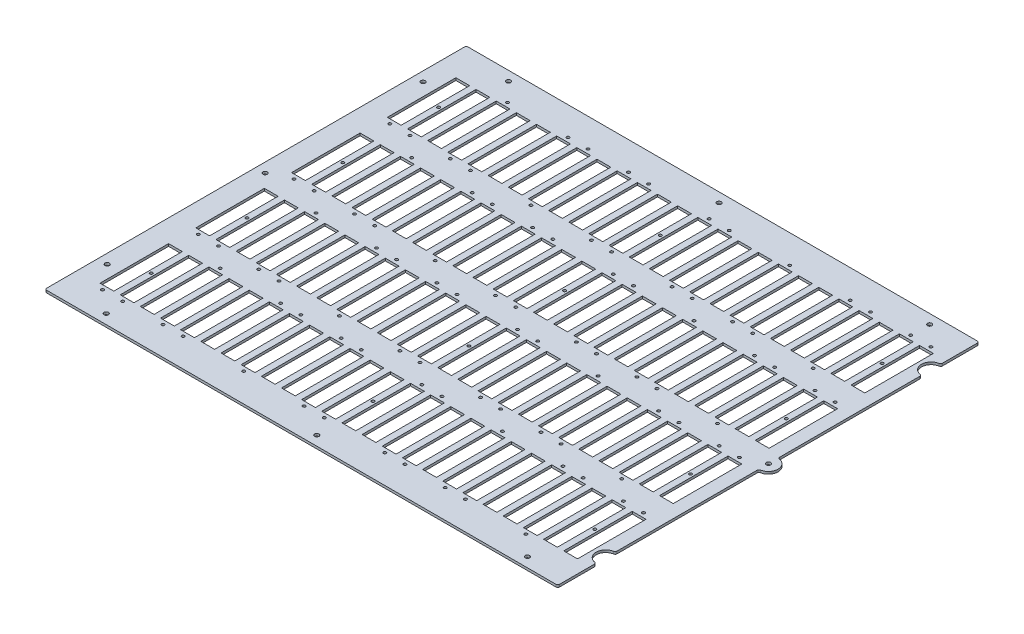
from build123d import *

# Parameters (mm, degrees)
BOSS_EXTRUDE1_DEPTH          = 3.175
SKETCH17_W                   = 18.288
SKETCH17_H                   = 90.932
CUT_EXTRUDE5_DEPTH           = 451.265762746
F_25_0_1495_DIAMETER_HOLE1_D = 3.7973
FILLET1_R                    = 2.54
F_6_CLEARANCE_HOLE1_D        = 3.7973
F_1_0_228_DIAMETER_HOLE1_D   = 5.7912


with BuildPart() as part:
    # Sketch1 → Boss-Extrude1 (new body)
    with BuildSketch(Plane(origin=(0, 0, 0), x_dir=(1, 0, 0), z_dir=(0, 1, 0))):
        with BuildLine():
            Line((340.2584, 228.6), (340.2584, 279.5524))
            Line((340.2584, 279.5524), (-340.2584, 279.5524))
            Line((-340.2584, 279.5524), (-340.2584, -279.5524))
            Line((-340.2584, -279.5524), (340.2584, -279.5524))
            Line((340.2584, -279.5524), (340.2584, -228.6))
            ThreePointArc((340.2584, -228.6), (327.5584, -215.9), (340.2584, -203.2))
            Line((340.2584, -203.2), (340.2584, -12.7))
            ThreePointArc((340.2584, -12.7), (352.9584, 0), (340.2584, 12.7))
            Line((340.2584, 12.7), (340.2584, 203.2))
            ThreePointArc((340.2584, 203.2), (327.5584, 215.9), (340.2584, 228.6))
        make_face()
    extrude(amount=BOSS_EXTRUDE1_DEPTH)

    # Sketch17 → Cut-Extrude5 (cut, through all)
    with BuildSketch(Plane(origin=(0, 3.175, 0), x_dir=(1, 0, 0), z_dir=(0, 1, 0))):
        with Locations((-274.696582609, 190.6524)):
            Rectangle(SKETCH17_W, SKETCH17_H)
        with Locations((-301.4472, 190.6524)):
            Rectangle(SKETCH17_W, SKETCH17_H)
        with Locations((-247.945965217, 190.6524)):
            Rectangle(SKETCH17_W, SKETCH17_H)
        with Locations((-221.195347826, 190.6524)):
            Rectangle(SKETCH17_W, SKETCH17_H)
        with Locations((-194.444730435, 190.6524)):
            Rectangle(SKETCH17_W, SKETCH17_H)
        with Locations((-167.694113043, 190.6524)):
            Rectangle(SKETCH17_W, SKETCH17_H)
        with Locations((-140.943495652, 190.6524)):
            Rectangle(SKETCH17_W, SKETCH17_H)
        with Locations((-114.192878261, 190.6524)):
            Rectangle(SKETCH17_W, SKETCH17_H)
        with Locations((-87.44226087, 190.6524)):
            Rectangle(SKETCH17_W, SKETCH17_H)
        with Locations((-60.691643478, 190.6524)):
            Rectangle(SKETCH17_W, SKETCH17_H)
        with Locations((-33.941026087, 190.6524)):
            Rectangle(SKETCH17_W, SKETCH17_H)
        with Locations((-7.190408696, 190.6524)):
            Rectangle(SKETCH17_W, SKETCH17_H)
        with Locations((19.560208696, 190.6524)):
            Rectangle(SKETCH17_W, SKETCH17_H)
        with Locations((46.310826087, 190.6524)):
            Rectangle(SKETCH17_W, SKETCH17_H)
        with Locations((73.061443478, 190.6524)):
            Rectangle(SKETCH17_W, SKETCH17_H)
        with Locations((99.81206087, 190.6524)):
            Rectangle(SKETCH17_W, SKETCH17_H)
        with Locations((126.562678261, 190.6524)):
            Rectangle(SKETCH17_W, SKETCH17_H)
        with Locations((153.313295652, 190.6524)):
            Rectangle(SKETCH17_W, SKETCH17_H)
        with Locations((180.063913043, 190.6524)):
            Rectangle(SKETCH17_W, SKETCH17_H)
        with Locations((206.814530435, 190.6524)):
            Rectangle(SKETCH17_W, SKETCH17_H)
        with Locations((233.565147826, 190.6524)):
            Rectangle(SKETCH17_W, SKETCH17_H)
        with Locations((260.315765217, 190.6524)):
            Rectangle(SKETCH17_W, SKETCH17_H)
        with Locations((287.066382609, 190.6524)):
            Rectangle(SKETCH17_W, SKETCH17_H)
        with Locations((313.817, 190.6524)):
            Rectangle(SKETCH17_W, SKETCH17_H)
        with Locations((-274.696582609, 63.5762)):
            Rectangle(SKETCH17_W, SKETCH17_H)
        with Locations((-247.945965217, 63.5762)):
            Rectangle(SKETCH17_W, SKETCH17_H)
        with Locations((-221.195347826, 63.5762)):
            Rectangle(SKETCH17_W, SKETCH17_H)
        with Locations((-194.444730435, 63.5762)):
            Rectangle(SKETCH17_W, SKETCH17_H)
        with Locations((-167.694113043, 63.5762)):
            Rectangle(SKETCH17_W, SKETCH17_H)
        with Locations((-140.943495652, 63.5762)):
            Rectangle(SKETCH17_W, SKETCH17_H)
        with Locations((-114.192878261, 63.5762)):
            Rectangle(SKETCH17_W, SKETCH17_H)
        with Locations((-87.44226087, 63.5762)):
            Rectangle(SKETCH17_W, SKETCH17_H)
        with Locations((-60.691643478, 63.5762)):
            Rectangle(SKETCH17_W, SKETCH17_H)
        with Locations((-33.941026087, 63.5762)):
            Rectangle(SKETCH17_W, SKETCH17_H)
        with Locations((-7.190408696, 63.5762)):
            Rectangle(SKETCH17_W, SKETCH17_H)
        with Locations((19.560208696, 63.5762)):
            Rectangle(SKETCH17_W, SKETCH17_H)
        with Locations((46.310826087, 63.5762)):
            Rectangle(SKETCH17_W, SKETCH17_H)
        with Locations((73.061443478, 63.5762)):
            Rectangle(SKETCH17_W, SKETCH17_H)
        with Locations((99.81206087, 63.5762)):
            Rectangle(SKETCH17_W, SKETCH17_H)
        with Locations((126.562678261, 63.5762)):
            Rectangle(SKETCH17_W, SKETCH17_H)
        with Locations((153.313295652, 63.5762)):
            Rectangle(SKETCH17_W, SKETCH17_H)
        with Locations((180.063913043, 63.5762)):
            Rectangle(SKETCH17_W, SKETCH17_H)
        with Locations((206.814530435, 63.5762)):
            Rectangle(SKETCH17_W, SKETCH17_H)
        with Locations((233.565147826, 63.5762)):
            Rectangle(SKETCH17_W, SKETCH17_H)
        with Locations((260.315765217, 63.5762)):
            Rectangle(SKETCH17_W, SKETCH17_H)
        with Locations((287.066382609, 63.5762)):
            Rectangle(SKETCH17_W, SKETCH17_H)
        with Locations((313.817, 63.5762)):
            Rectangle(SKETCH17_W, SKETCH17_H)
        with Locations((-274.696582609, -63.5)):
            Rectangle(SKETCH17_W, SKETCH17_H)
        with Locations((-247.945965217, -63.5)):
            Rectangle(SKETCH17_W, SKETCH17_H)
        with Locations((-221.195347826, -63.5)):
            Rectangle(SKETCH17_W, SKETCH17_H)
        with Locations((-194.444730435, -63.5)):
            Rectangle(SKETCH17_W, SKETCH17_H)
        with Locations((-167.694113043, -63.5)):
            Rectangle(SKETCH17_W, SKETCH17_H)
        with Locations((-140.943495652, -63.5)):
            Rectangle(SKETCH17_W, SKETCH17_H)
        with Locations((-114.192878261, -63.5)):
            Rectangle(SKETCH17_W, SKETCH17_H)
        with Locations((-87.44226087, -63.5)):
            Rectangle(SKETCH17_W, SKETCH17_H)
        with Locations((-60.691643478, -63.5)):
            Rectangle(SKETCH17_W, SKETCH17_H)
        with Locations((-33.941026087, -63.5)):
            Rectangle(SKETCH17_W, SKETCH17_H)
        with Locations((-7.190408696, -63.5)):
            Rectangle(SKETCH17_W, SKETCH17_H)
        with Locations((19.560208696, -63.5)):
            Rectangle(SKETCH17_W, SKETCH17_H)
        with Locations((46.310826087, -63.5)):
            Rectangle(SKETCH17_W, SKETCH17_H)
        with Locations((73.061443478, -63.5)):
            Rectangle(SKETCH17_W, SKETCH17_H)
        with Locations((99.81206087, -63.5)):
            Rectangle(SKETCH17_W, SKETCH17_H)
        with Locations((126.562678261, -63.5)):
            Rectangle(SKETCH17_W, SKETCH17_H)
        with Locations((153.313295652, -63.5)):
            Rectangle(SKETCH17_W, SKETCH17_H)
        with Locations((180.063913043, -63.5)):
            Rectangle(SKETCH17_W, SKETCH17_H)
        with Locations((206.814530435, -63.5)):
            Rectangle(SKETCH17_W, SKETCH17_H)
        with Locations((233.565147826, -63.5)):
            Rectangle(SKETCH17_W, SKETCH17_H)
        with Locations((260.315765217, -63.5)):
            Rectangle(SKETCH17_W, SKETCH17_H)
        with Locations((287.066382609, -63.5)):
            Rectangle(SKETCH17_W, SKETCH17_H)
        with Locations((313.817, -63.5)):
            Rectangle(SKETCH17_W, SKETCH17_H)
        with Locations((-274.696582609, -190.5762)):
            Rectangle(SKETCH17_W, SKETCH17_H)
        with Locations((-247.945965217, -190.5762)):
            Rectangle(SKETCH17_W, SKETCH17_H)
        with Locations((-221.195347826, -190.5762)):
            Rectangle(SKETCH17_W, SKETCH17_H)
        with Locations((-194.444730435, -190.5762)):
            Rectangle(SKETCH17_W, SKETCH17_H)
        with Locations((-167.694113043, -190.5762)):
            Rectangle(SKETCH17_W, SKETCH17_H)
        with Locations((-140.943495652, -190.5762)):
            Rectangle(SKETCH17_W, SKETCH17_H)
        with Locations((-114.192878261, -190.5762)):
            Rectangle(SKETCH17_W, SKETCH17_H)
        with Locations((-87.44226087, -190.5762)):
            Rectangle(SKETCH17_W, SKETCH17_H)
        with Locations((-60.691643478, -190.5762)):
            Rectangle(SKETCH17_W, SKETCH17_H)
        with Locations((-33.941026087, -190.5762)):
            Rectangle(SKETCH17_W, SKETCH17_H)
        with Locations((-7.190408696, -190.5762)):
            Rectangle(SKETCH17_W, SKETCH17_H)
        with Locations((19.560208696, -190.5762)):
            Rectangle(SKETCH17_W, SKETCH17_H)
        with Locations((46.310826087, -190.5762)):
            Rectangle(SKETCH17_W, SKETCH17_H)
        with Locations((73.061443478, -190.5762)):
            Rectangle(SKETCH17_W, SKETCH17_H)
        with Locations((99.81206087, -190.5762)):
            Rectangle(SKETCH17_W, SKETCH17_H)
        with Locations((126.562678261, -190.5762)):
            Rectangle(SKETCH17_W, SKETCH17_H)
        with Locations((153.313295652, -190.5762)):
            Rectangle(SKETCH17_W, SKETCH17_H)
        with Locations((180.063913043, -190.5762)):
            Rectangle(SKETCH17_W, SKETCH17_H)
        with Locations((206.814530435, -190.5762)):
            Rectangle(SKETCH17_W, SKETCH17_H)
        with Locations((233.565147826, -190.5762)):
            Rectangle(SKETCH17_W, SKETCH17_H)
        with Locations((260.315765217, -190.5762)):
            Rectangle(SKETCH17_W, SKETCH17_H)
        with Locations((287.066382609, -190.5762)):
            Rectangle(SKETCH17_W, SKETCH17_H)
        with Locations((313.817, -190.5762)):
            Rectangle(SKETCH17_W, SKETCH17_H)
        with Locations((-301.4472, 63.5762)):
            Rectangle(SKETCH17_W, SKETCH17_H)
        with Locations((-301.4472, -63.5)):
            Rectangle(SKETCH17_W, SKETCH17_H)
        with Locations((-301.4472, -190.5762)):
            Rectangle(SKETCH17_W, SKETCH17_H)
    extrude(amount=-CUT_EXTRUDE5_DEPTH, mode=Mode.SUBTRACT)

    # #25 (0.1495) Diameter Hole1 (through all)
    with Locations(Plane(origin=(0, 3.175, 0), x_dir=(1, 0, 0), z_dir=(0, 1, 0))):
        with Locations((-301.447198222, 139.3444), (313.817, -139.2682), (287.066382686, -139.2682), (260.315765372, -241.8842), (233.565148058, -139.2682), (206.814530744, -139.2682), (180.06391343, -241.8842), (153.313296116, -241.8842), (126.562678802, -139.2682), (99.812061488, -241.8842), (73.061444174, -241.8842), (46.31082686, -139.2682), (19.560209546, -139.2682), (-7.190407768, -241.8842), (-33.941025082, -241.8842), (-60.691642396, -139.2682), (-87.44225971, -139.2682), (-114.192877024, -241.8842), (-140.943494338, -139.2682), (-167.694111652, -139.2682), (-194.444728966, -241.8842), (-221.19534628, -241.8842), (-247.945963594, -139.2682), (-274.696580908, -241.8842), (-301.447198222, -241.8842), (313.817, -12.192), (287.066382686, -12.192), (260.315765372, -114.808), (233.565148058, -12.192), (206.814530744, -12.192), (180.06391343, -114.808), (153.313296116, -114.808), (126.562678802, -12.192), (99.812061488, -114.808), (73.061444174, -114.808), (46.31082686, -12.192), (19.560209546, -12.192), (-7.190407768, -114.808), (-33.941025082, -114.808), (-60.691642396, -12.192), (-87.44225971, -12.192), (-114.192877024, -114.808), (-140.943494338, -12.192), (-167.694111652, -12.192), (-194.444728966, -114.808), (-221.19534628, -114.808), (-247.945963594, -12.192), (-274.696580908, -114.808), (-301.447198222, -114.808), (313.817, 114.8842), (287.066382686, 114.8842), (260.315765372, 12.2682), (233.565148058, 114.8842), (206.814530744, 114.8842), (180.06391343, 12.2682), (153.313296116, 12.2682), (126.562678802, 114.8842), (99.812061488, 12.2682), (73.061444174, 12.2682), (46.31082686, 114.8842), (19.560209546, 114.8842), (-7.190407768, 12.2682), (-33.941025082, 12.2682), (-60.691642396, 114.8842), (-87.44225971, 114.8842), (-114.192877024, 12.2682), (-140.943494338, 114.8842), (-167.694111652, 114.8842), (-194.444728966, 12.2682), (-221.19534628, 12.2682), (-247.945963594, 114.8842), (-274.696580908, 12.2682), (-301.447198222, 12.2682), (313.817, 241.9604), (287.066382686, 241.9604), (260.315765372, 139.3444), (233.565148058, 241.9604), (206.814530744, 241.9604), (180.06391343, 139.3444), (153.313296116, 139.3444), (126.562678802, 241.9604), (99.812061488, 139.3444), (73.061444174, 139.3444), (46.31082686, 241.9604), (19.560209546, 241.9604), (-7.190407768, 139.3444), (-33.941025082, 139.3444), (-60.691642396, 241.9604), (-87.44225971, 241.9604), (-114.192877024, 139.3444), (-140.943494338, 241.9604), (-167.694111652, 241.9604), (-194.444728966, 139.3444), (-221.19534628, 139.3444), (-247.945963594, 241.9604), (-274.696580908, 139.3444)):
            Hole(F_25_0_1495_DIAMETER_HOLE1_D / 2)

    # Fillet1
    fillet1_edges = [part.edges().sort_by_distance(p)[0] for p in [
        (-340.2584, 1.5875, -279.5524),
        (-340.2584, 1.5875, 279.5524),
        (340.2584, 1.5875, 279.5524),
        (340.2584, 1.5875, 228.6),
        (340.2584, 1.5875, 203.2),
        (340.2584, 1.5875, 12.7),
        (340.2584, 1.5875, -12.7),
        (340.2584, 1.5875, -203.2),
        (340.2584, 1.5875, -279.5524),
        (340.2584, 1.5875, -228.6),
    ]]
    fillet(fillet1_edges, radius=FILLET1_R)

    # #6 Clearance Hole1 (through all)
    with Locations(Plane(origin=(0, 3.175, 0), x_dir=(1, 0, 0), z_dir=(0, 1, 0))):
        with Locations((300.441691304, -190.5762), (-288.071891304, 190.6524), (6.1849, 190.6524), (300.441691304, 190.6524), (-288.071891304, 63.5762), (6.1849, 63.5762), (300.441691304, 63.5762), (-288.071891304, -63.5), (6.1849, -63.5), (300.441691304, -63.5), (-288.071891304, -190.5762), (6.1849, -190.5762)):
            Hole(F_6_CLEARANCE_HOLE1_D / 2)

    # #1 (0.228) Diameter Hole1 (through all)
    with Locations(Plane(origin=(0, 3.175, 0), x_dir=(1, 0, 0), z_dir=(0, 1, 0))):
        with Locations((287.274, -266.8524), (287.274, 266.8524), (7.874, 266.8524), (-271.526, 266.8524), (-327.5584, 209.55), (-327.5584, 0), (-327.5584, -209.55), (-271.526, -266.8524), (7.874, -266.8524), (340.2584, 0)):
            Hole(F_1_0_228_DIAMETER_HOLE1_D / 2)


solid = part.part
